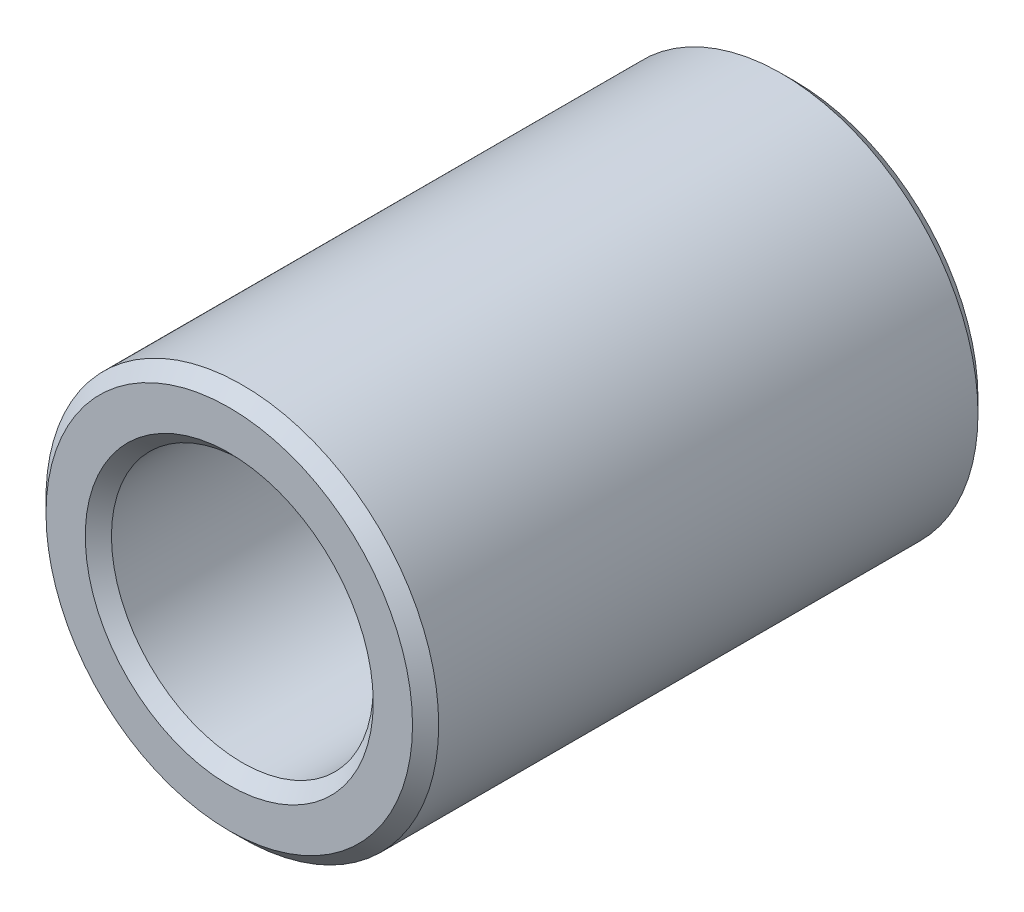
from build123d import *

# Parameters (mm, degrees)
SKIZZE1_R                       = 1.5
SKIZZE1_R_2                     = 1
AUFSATZ_LINEAR_AUSTRAGEN1_DEPTH = 4.32
FASE1_SIZE                      = 0.1


with BuildPart() as part:
    # Skizze1 → Aufsatz-Linear austragen1 (new body)
    with BuildSketch(Plane.XY):
        Circle(SKIZZE1_R)
        Circle(SKIZZE1_R_2, mode=Mode.SUBTRACT)
    extrude(amount=AUFSATZ_LINEAR_AUSTRAGEN1_DEPTH)

    # Fase1
    fase1_edges = [part.edges().sort_by_distance(p)[0] for p in [
        (-1, 0, 0),
        (-1.5, 0, 0),
        (-1, 0, 4.32),
        (-1.5, 0, 4.32),
    ]]
    chamfer(fase1_edges, length=FASE1_SIZE)


solid = part.part
